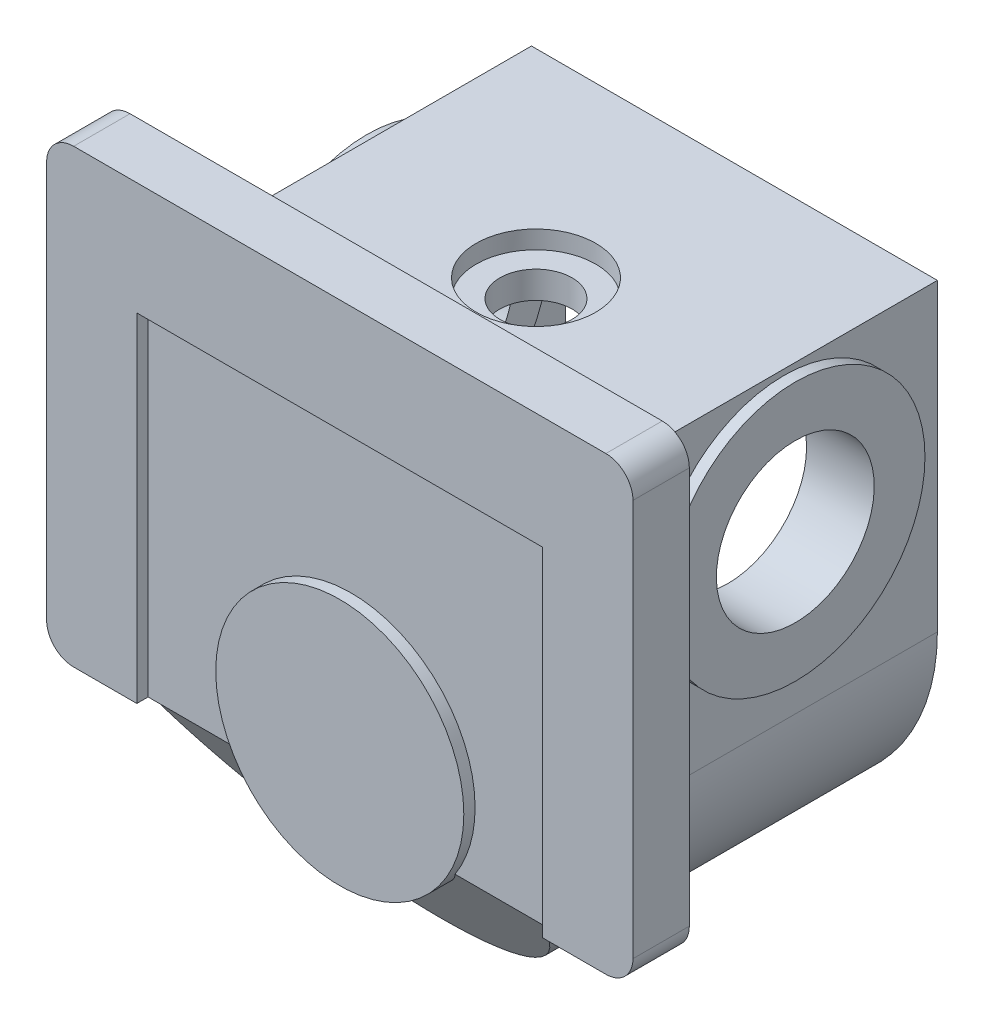
from build123d import *

# Parameters (mm, degrees)
EXTRUDE_START                = -5
EXTRUDE_1_DEPTH              = 170
CUT_EXTRUDE_1_DEPTH          = 239.641991276
CUT_EXTRUDE_1_DEPTH_BACK     = 239.641991276
CUT_EXTRUDE_START            = -121.972243623
CUT_EXTRUDE_2_DEPTH          = 121.972243623
CUT_EXTRUDE_START_2          = -53.027756377
CUT_EXTRUDE_2_2_DEPTH        = 28.027756377
CUT_EXTRUDE_START_3          = -12.480754415
CUT_EXTRUDE_2_3_DEPTH        = 15
SKETCH_5_R                   = 55
EXTRUDE_2_DEPTH              = 60.5
SKETCH_6_W                   = 260
SKETCH_6_H                   = 200
EXTRUDE_3_DEPTH              = 25
CUT_EXTRUDE_3_DEPTH          = 5
FILLET_1_R                   = 12
SKETCH_9_R                   = 57.5
EXTRUDE_4_DEPTH              = 5
SKETCH_10_R                  = 50
EXTRUDE_5_DEPTH              = 30
CUT_EXTRUDE_4_DEPTH          = 332.888535558
CUT_EXTRUDE_4_DEPTH_BACK     = 332.888535558
SKETCH_11_R                  = 35
CUT_EXTRUDE_5_DEPTH          = 314.289004012
CUT_EXTRUDE_5_DEPTH_BACK     = 8
SKETCH_12_R                  = 26.5
CUT_EXTRUDE_6_REACH          = 309.594
SKETCH_13_R                  = 16
RIB_START                    = -7.5
RIB_1_DEPTH                  = 15
RIB_2_REACH                  = 278.451
SKETCH_15_WALL_W             = 586.29307431
SKETCH_15_WALL_H             = 15
HOLE_WIZARD_M6_1_D           = 5
HOLE_WIZARD_M6_1_DEPTH       = 22
HOLE_WIZARD_M6_1_CSINK_D     = 6.05
HOLE_WIZARD_M6_1_CSINK_ANGLE = 90
HOLE_WIZARD_M6_1_TIP         = 1.502151548
HOLE_WIZARD_M6_2_D           = 5
HOLE_WIZARD_M6_2_DEPTH       = 22
HOLE_WIZARD_M6_2_CSINK_D     = 6.05
HOLE_WIZARD_M6_2_CSINK_ANGLE = 90
HOLE_WIZARD_M6_2_TIP         = 1.502151548


with BuildPart() as part:
    # 草图1 → 凸台-拉伸1 (new body)
    with BuildSketch(Plane.XY.offset(EXTRUDE_START)):
        with BuildLine():
            Line((-90, 0), (-90, 135))
            Line((-90, 135), (90, 135))
            Line((90, 135), (90, 0))
            ThreePointArc((90, 0), (0, -90), (-90, 0))
        make_face()
    extrude(amount=-EXTRUDE_1_DEPTH)

    # 草图2 → 切除-拉伸1 (cut, two sides: drawn at the far end of the back side and taken through both)
    with BuildSketch(Plane(origin=(0, 0, 0), x_dir=(0, 0, -1), z_dir=(1, 0, 0)).offset(-CUT_EXTRUDE_1_DEPTH_BACK)):
        Polygon((338.831049921, -530.746574882), (45, -90), (5, -30), (-288.831049921, 410.746574882), (-1170.324199685, -176.915524961), (-542.662099843, -1118.408674725), align=None)
    extrude(amount=CUT_EXTRUDE_1_DEPTH + CUT_EXTRUDE_1_DEPTH_BACK, mode=Mode.SUBTRACT)

    # 切除-拉伸2: read off the stored shape, not the designer's step
    # 切除-拉伸2 outline → 切除-拉伸2 (cut)
    with BuildSketch(Plane(origin=(0, 0, -175), x_dir=(-1, 0, 0), z_dir=(0, 0, -1)).offset(CUT_EXTRUDE_START)):
        with BuildLine():
            Line((75, 115), (-75, 115))
            Line((-75, 115), (-75, 0))
            ThreePointArc((-75, 0), (0, -75), (75, 0))
            Line((75, 0), (75, 115))
        make_face()
    extrude(amount=CUT_EXTRUDE_2_DEPTH, mode=Mode.SUBTRACT)

    # Cut-Extrude 2 2 outline → Cut-Extrude 2 2 (cut)
    with BuildSketch(Plane.XY.offset(CUT_EXTRUDE_START_2)):
        with BuildLine():
            ThreePointArc((-75, 0), (0, -75), (75, 0))
            Line((75, 0), (75, 115))
            Line((75, 115), (-75, 115))
            Line((-75, 115), (-75, 0))
        make_face()
    extrude(amount=CUT_EXTRUDE_2_2_DEPTH, mode=Mode.SUBTRACT)

    # Cut-Extrude 2 3 outline → Cut-Extrude 2 3 (add)
    with BuildSketch(Plane(origin=(0, 0, 0), x_dir=(1, 0, 0), z_dir=(0, 0.5547001962252289, -0.8320502943378438)).offset(CUT_EXTRUDE_START_3)):
        with BuildLine():
            Line((-67.370217069, 41.290522566), (67.370217069, 41.290522566))
            add(Edge.make_bspline(
                [(67.370217069, 41.290522566), (0, 206.799154918), (-67.370217069, 41.290522566)],
                knots=[5.167369564, 5.167369564, 5.167369564, 7.399001051, 7.399001051, 7.399001051], degree=2, weights=[1, 0.439444872, 1]))
        make_face()
    extrude(amount=CUT_EXTRUDE_2_3_DEPTH)

    # 草图5 → 凸台-拉伸2 (add)
    with BuildSketch(Plane.XY):
        Circle(SKETCH_5_R)
    extrude(amount=-EXTRUDE_2_DEPTH)

    # 草图6 → 凸台-拉伸3 (add)
    with BuildSketch(Plane.XY):
        with Locations((0, 70)):
            Rectangle(SKETCH_6_W, SKETCH_6_H)
    extrude(amount=-EXTRUDE_3_DEPTH)

    # 草图8 → 切除-拉伸3 (cut)
    with BuildSketch(Plane.XY):
        with BuildLine():
            Line((-90, -30), (-90, 120))
            Line((-90, 120), (90, 120))
            Line((90, 120), (90, -30))
            Line((90, -30), (46.097722286, -30))
            ThreePointArc((46.097722286, -30), (0, 55), (-46.097722286, -30))
            Line((-46.097722286, -30), (-90, -30))
        make_face()
    extrude(amount=-CUT_EXTRUDE_3_DEPTH, mode=Mode.SUBTRACT)

    # 圆角1
    fillet_1_edges = [part.edges().sort_by_distance(p)[0] for p in [
        (130, -30, -12.5),
        (130, 170, -12.5),
        (-130, -30, -12.5),
        (-130, 170, -12.5),
    ]]
    fillet(fillet_1_edges, radius=FILLET_1_R)

    # 草图9 → 凸台-拉伸4 (add)
    with BuildSketch(Plane(origin=(90, 0, 0), x_dir=(0, 0, -1), z_dir=(1, 0, 0))):
        with Locations(Location((107, 75, 0), (0, 0, 90))):
            Circle(SKETCH_9_R)
    extrude_4 = extrude(amount=EXTRUDE_4_DEPTH)

    # 草图10 → 凸台-拉伸5 (add)
    with BuildSketch(Plane.ZY.offset(-95)):
        with Locations((-107, 75)):
            Circle(SKETCH_10_R)
    extrude_5 = extrude(amount=EXTRUDE_5_DEPTH)

    # 镜向1: 凸台-拉伸4, 凸台-拉伸5 across plane
    add(extrude_4.mirror(Plane(origin=(0, 0, 0), x_dir=(0, 0, 1), z_dir=(1, 0, 0))))
    add(extrude_5.mirror(Plane(origin=(0, 0, 0), x_dir=(0, 0, 1), z_dir=(1, 0, 0))))

    # 草图11 → 切除-拉伸4 (cut, two sides: drawn at the far end of the back side and taken through both)
    with BuildSketch(Plane(origin=(95, 0, 0), x_dir=(0, 0, -1), z_dir=(1, 0, 0)).offset(-CUT_EXTRUDE_4_DEPTH_BACK)):
        with Locations(Location((107, 75, 0), (0, 0, 90))):
            Circle(SKETCH_11_R)
    extrude(amount=CUT_EXTRUDE_4_DEPTH + CUT_EXTRUDE_4_DEPTH_BACK, mode=Mode.SUBTRACT)

    # 草图12 → 切除-拉伸5 (cut, two sides: drawn at the far end of the back side and taken through both)
    with BuildSketch(Plane(origin=(0, 135, 0), x_dir=(1, 0, 0), z_dir=(0, 1, 0)).offset(-CUT_EXTRUDE_5_DEPTH_BACK)):
        with Locations((0, 87)):
            Circle(SKETCH_12_R)
    extrude(amount=CUT_EXTRUDE_5_DEPTH + CUT_EXTRUDE_5_DEPTH_BACK, mode=Mode.SUBTRACT)

    # 草图13 → 切除-拉伸6 (cut, up to next)
    with BuildSketch(Plane(origin=(0, 127, 0), x_dir=(1, 0, 0), z_dir=(0, 1, 0)), mode=Mode.PRIVATE) as cut_extrude_6_sk1:
        with Locations(Location((0, 87, 0), (0, 0, 180))):
            Circle(SKETCH_13_R)
    cut_extrude_6_tool1 = extrude(cut_extrude_6_sk1.sketch, amount=-CUT_EXTRUDE_6_REACH, mode=Mode.PRIVATE) & part.part
    add(cut_extrude_6_tool1.solids().sort_by_distance((0, 127, -87))[0], mode=Mode.SUBTRACT)

    # 筋1: read off the stored shape, not the designer's step
    # 筋1 outline → 筋1 (add)
    with BuildSketch(Plane(origin=(0, 0, 0), x_dir=(0, 0, -1), z_dir=(1, 0, 0)).offset(RIB_START)):
        Polygon((55.5, -76), (55.5, -53), (38.361089711, -53), (53.027756377, -75), (53.694423044, -76), align=None)
    extrude(amount=RIB_1_DEPTH)

    # 草图15 wall → 筋2 (add, up to next)
    with BuildSketch(Plane(origin=(59.304181844, 0, -55.5), x_dir=(-1, 0, 0), z_dir=(0, 0, 1)), mode=Mode.PRIVATE) as rib_2_sk1:
        Rectangle(SKETCH_15_WALL_W, SKETCH_15_WALL_H)
    rib_2_tool1 = extrude(rib_2_sk1.sketch, amount=RIB_2_REACH, mode=Mode.PRIVATE) - part.part
    rib_2 = rib_2_tool1.solids().sort_by_distance((59.304181844, 0, -55.5))[0]
    add(rib_2)

    # 镜向4: 筋2 across plane
    add(rib_2.mirror(Plane(origin=(0, 0, 0), x_dir=(0, 0, 1), z_dir=(1, 0, 0))))

    # M6 螺纹孔1
    with Locations(Plane(origin=(0, 0, -175), x_dir=(-1, 0, 0), z_dir=(0, 0, -1))):
        with Locations((82, 125), (-82, 125)):
            CounterSinkHole(HOLE_WIZARD_M6_1_D / 2, HOLE_WIZARD_M6_1_CSINK_D / 2, depth=HOLE_WIZARD_M6_1_DEPTH, counter_sink_angle=HOLE_WIZARD_M6_1_CSINK_ANGLE)
            with Locations((0, 0, -(HOLE_WIZARD_M6_1_DEPTH + HOLE_WIZARD_M6_1_TIP / 2))):  # 118° drill point
                Cone(0, HOLE_WIZARD_M6_1_D / 2, HOLE_WIZARD_M6_1_TIP, mode=Mode.SUBTRACT)

    # M6 螺纹孔2
    with Locations(Plane(origin=(0, 0, -175), x_dir=(-1, 0, 0), z_dir=(0, 0, -1))):
        with Locations((0, -82)):
            CounterSinkHole(HOLE_WIZARD_M6_2_D / 2, HOLE_WIZARD_M6_2_CSINK_D / 2, depth=HOLE_WIZARD_M6_2_DEPTH, counter_sink_angle=HOLE_WIZARD_M6_2_CSINK_ANGLE)
            with Locations((0, 0, -(HOLE_WIZARD_M6_2_DEPTH + HOLE_WIZARD_M6_2_TIP / 2))):  # 118° drill point
                Cone(0, HOLE_WIZARD_M6_2_D / 2, HOLE_WIZARD_M6_2_TIP, mode=Mode.SUBTRACT)


solid = part.part
